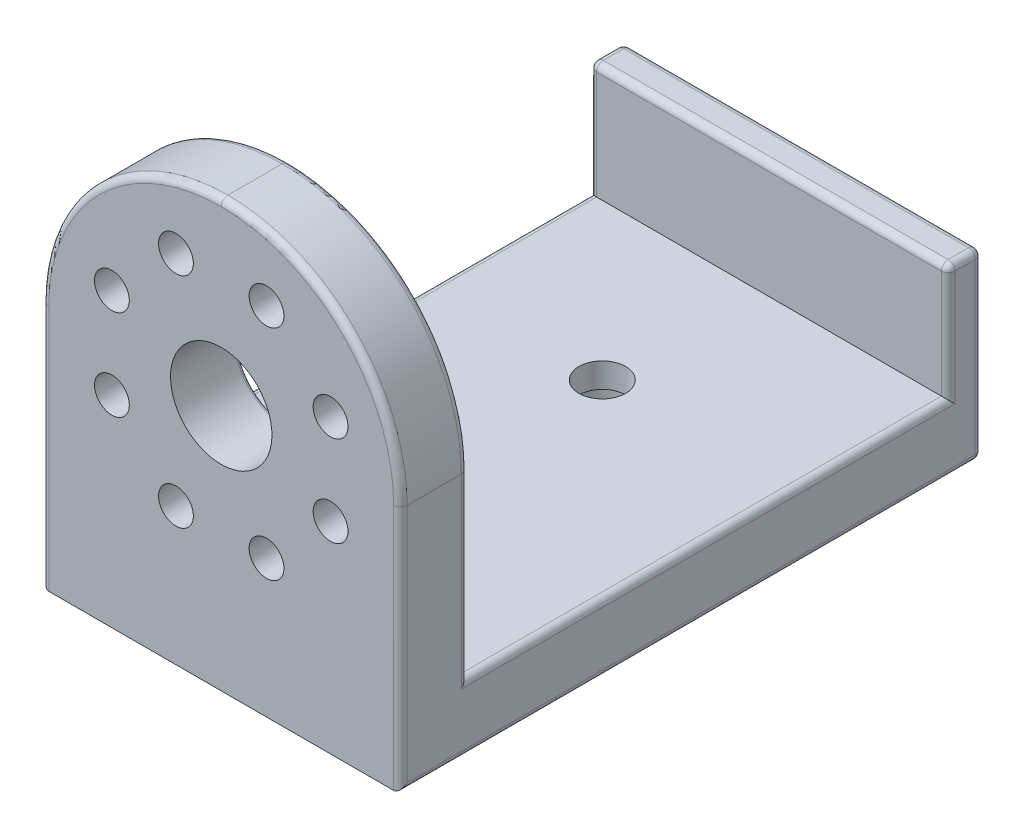
from build123d import *

# Parameters (mm, degrees)
BOSS_EXTRUDE1_DEPTH = 26.5
SKETCH3_R           = 2.575
SKETCH3_R_2         = 7.5
CUT_EXTRUDE1_DEPTH  = 90.053618868
SKETCH4_R           = 4.35
SKETCH4_R_2         = 7.5
CUT_EXTRUDE2_DEPTH  = 5
FILLET1_R           = 26.5
SKETCH9_R           = 3.452866181
CUT_EXTRUDE8_DEPTH  = 30
SKETCH10_R          = 4.825
CUT_EXTRUDE9_DEPTH  = 6.35
FILLET2_R           = 1
FILLET3_R           = 0.5


with BuildPart() as part:
    # Sketch2 → Boss-Extrude1 (new, symmetric)
    with BuildSketch(Plane(origin=(0, 0, 0), x_dir=(0, 0, -1), z_dir=(1, 0, 0))):
        Polygon((-34.927247405, -24.890984879), (-24.927247405, -24.890984879), (46.072752595, -24.890984879), (51.072752595, -24.890984879), (51.072752595, 2.109015121), (46.072752595, 2.109015121), (46.072752595, -14.890984879), (-24.927247405, -14.890984879), (-24.927247405, 38.109015121), (-34.927247405, 38.109015121), align=None)
    extrude(amount=BOSS_EXTRUDE1_DEPTH, both=True)

    # Sketch3 → Cut-Extrude1 (cut, through all)
    with BuildSketch(Plane(origin=(0, 0, 24.927247405), x_dir=(-1, 0, 0), z_dir=(0, 0, -1))):
        with Locations(Location((-6.696960066, 27.77690694, 0), (0, 0, 90))):
            Circle(SKETCH3_R)
        with Locations(Location((0, 11.609015121, 0), (0, 0, 90))):
            Circle(SKETCH3_R_2)
        with Locations(Location((6.696960066, 27.77690694, 0), (0, 0, 90))):
            Circle(SKETCH3_R)
        with Locations(Location((16.167891819, 18.305975187, 0), (0, 0, 90))):
            Circle(SKETCH3_R)
        with Locations(Location((16.167891819, 4.912055054, 0), (0, 0, 90))):
            Circle(SKETCH3_R)
        with Locations(Location((6.696960066, -4.558876698, 0), (0, 0, 90))):
            Circle(SKETCH3_R)
        with Locations(Location((-6.696960066, -4.558876698, 0), (0, 0, 90))):
            Circle(SKETCH3_R)
        with Locations(Location((-16.167891819, 4.912055054, 0), (0, 0, 90))):
            Circle(SKETCH3_R)
        with Locations(Location((-16.167891819, 18.305975187, 0), (0, 0, 90))):
            Circle(SKETCH3_R)
    extrude(amount=-CUT_EXTRUDE1_DEPTH, mode=Mode.SUBTRACT)

    # Sketch4 → Cut-Extrude2 (cut)
    with BuildSketch(Plane(origin=(0, 0, 24.927247405), x_dir=(-1, 0, 0), z_dir=(0, 0, -1))):
        with Locations(Location((6.696960066, -4.558876698, 0), (0, 0, 90))):
            Circle(SKETCH4_R)
        with Locations(Location((16.167891819, 18.305975187, 0), (0, 0, 90))):
            Circle(SKETCH4_R)
        with Locations(Location((6.696960066, 27.77690694, 0), (0, 0, 90))):
            Circle(SKETCH4_R)
        with Locations(Location((0, 11.609015121, 0), (0, 0, 90))):
            Circle(SKETCH4_R_2)
        with Locations(Location((-6.696960066, 27.77690694, 0), (0, 0, 90))):
            Circle(SKETCH4_R)
        with Locations(Location((-16.167891819, 18.305975187, 0), (0, 0, 90))):
            Circle(SKETCH4_R)
        with Locations(Location((-16.167891819, 4.912055054, 0), (0, 0, 90))):
            Circle(SKETCH4_R)
        with Locations(Location((-6.696960066, -4.558876698, 0), (0, 0, 90))):
            Circle(SKETCH4_R)
        with Locations(Location((16.167891819, 4.912055054, 0), (0, 0, 90))):
            Circle(SKETCH4_R)
    extrude(amount=-CUT_EXTRUDE2_DEPTH, mode=Mode.SUBTRACT)

    # Fillet1
    fillet1_edges = [part.edges().sort_by_distance(p)[0] for p in [
        (-26.5, 38.109015121, 29.927247405),
        (26.5, 38.109015121, 29.927247405),
    ]]
    fillet(fillet1_edges, radius=FILLET1_R - 0.0001)  # a hair under: the kernel refuses the full size

    # Sketch9 → Cut-Extrude8 (cut)
    with BuildSketch(Plane(origin=(0, -14.890984879, 0), x_dir=(1, 0, 0), z_dir=(0, 1, 0))):
        with Locations(Location((-1.65, 23.072752595, 0), (0, 0, 270))):
            Circle(SKETCH9_R)
    extrude(amount=-CUT_EXTRUDE8_DEPTH, mode=Mode.SUBTRACT)

    # Sketch10 → Cut-Extrude9 (cut)
    with BuildSketch(Plane.XZ.offset(24.890984879)):
        with Locations(Location((-1.65, -23.072752595, 0), (0, 0, 270))):
            Circle(SKETCH10_R)
    extrude(amount=-CUT_EXTRUDE9_DEPTH, mode=Mode.SUBTRACT)

    # Fillet2
    fillet2_edges = [part.edges().sort_by_distance(p)[0] for p in [
        (-26.5, -14.890984879, -10.572752595),
        (-26.5, -6.390984879, -46.072752595),
        (-26.5, 2.109015121, -48.572752595),
        (-26.5, -11.390984879, -51.072752595),
        (-26.5, -6.640934879, 34.927247405),
        (26.5, -6.640934879, 34.927247405),
        (-26.5, -24.890984879, -8.072752595),
        (18.738358991, 30.347374111, 34.927247405),
        (-18.738358991, 30.347374111, 34.927247405),
        (18.738358991, 30.347374111, 24.927247405),
        (-18.738358991, 30.347374111, 24.927247405),
        (-26.5, -1.640934879, 24.927247405),
        (26.5, -24.890984879, -8.072752595),
        (0, 2.109015121, -46.072752595),
        (0, 2.109015121, -51.072752595),
        (0, -24.890984879, -51.072752595),
        (26.5, -11.390984879, -51.072752595),
        (26.5, 2.109015121, -48.572752595),
        (26.5, -6.390984879, -46.072752595),
        (26.5, -14.890984879, -10.572752595),
        (26.5, -1.640934879, 24.927247405),
    ]]
    fillet(fillet2_edges, radius=FILLET2_R)

    # Fillet3
    fillet3_edges = [part.edges().sort_by_distance(p)[0] for p in [
        (-6.696960066, -8.908876698, 24.927247405),
        (-1.65, -24.890984879, -18.247752595),
        (0, 4.109015121, 24.927247405),
        (6.696960066, 23.42690694, 24.927247405),
        (-6.696960066, 23.42690694, 24.927247405),
        (-16.167891819, 13.955975187, 24.927247405),
        (16.167891819, 13.955975187, 24.927247405),
        (16.167891819, 0.562055054, 24.927247405),
        (6.696960066, -8.908876698, 24.927247405),
        (-16.167891819, 0.562055054, 24.927247405),
    ]]
    fillet(fillet3_edges, radius=FILLET3_R)


solid = part.part
